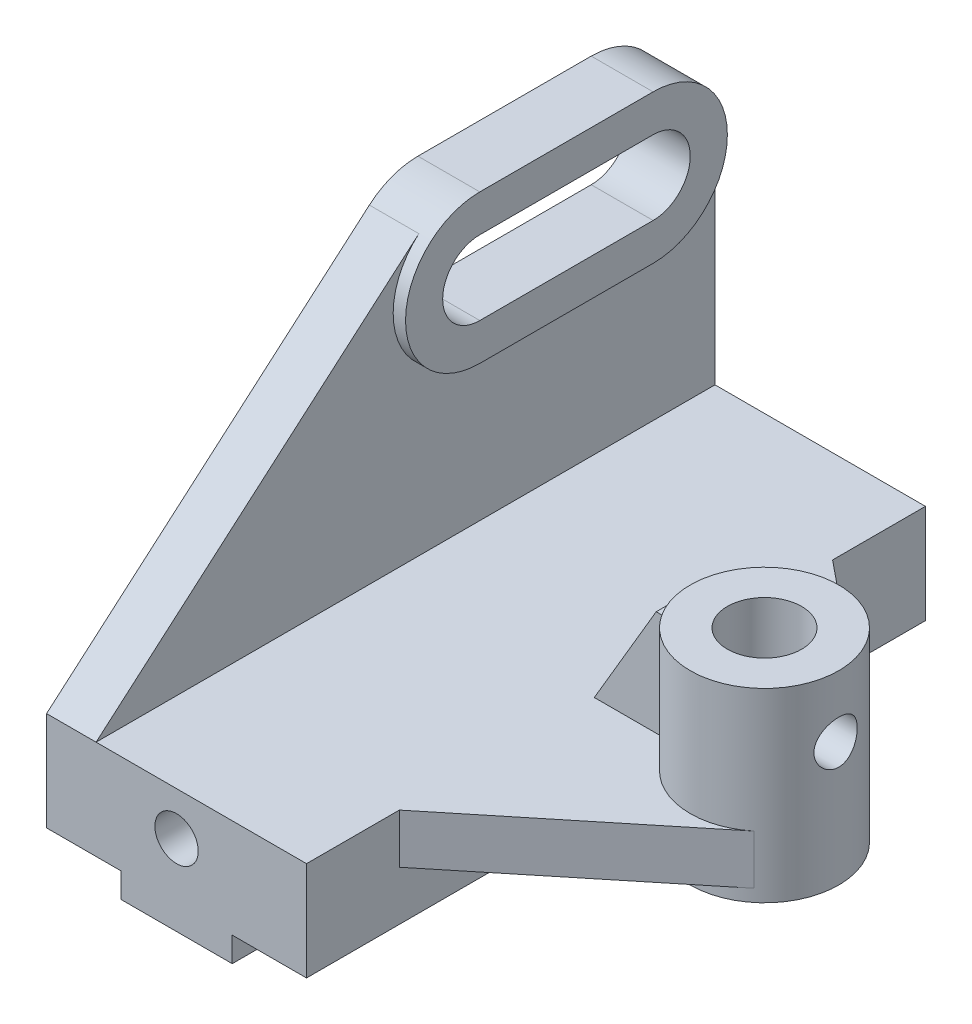
from build123d import *

# Parameters (mm, degrees)
SKETCH_1_R           = 3.5
EXTRUDE_1_DEPTH      = 50
EXTRUDE_2_DEPTH      = 8
EXTRUDE_3_DEPTH      = 10
EXTRUDE_4_DEPTH      = 8
EXTRUDE_5_DEPTH      = 20
EXTRUDE_5_DEPTH_BACK = 10
SKETCH_3_3_R         = 12
SKETCH_3_3_R_2       = 6
RIB_START            = -3.5
RIB_12_DEPTH         = 7
CUT_EXTRUDE_START    = 49.873397053
CUT_EXTRUDE_1_DEPTH  = 7.126602664


# Read off the part's stored shape, not the designer's step: 筋12, 切除-拉伸1
with BuildPart() as part:
    # 草图1 → 凸台-拉伸1 (new, symmetric)
    with BuildSketch(Plane.XY):
        Polygon((21, 7), (-21, 7), (-21, -9), (-9, -9), (-9, -13), (9, -13), (9, -9), (21, -9), align=None)
        Circle(SKETCH_1_R, mode=Mode.SUBTRACT)
    extrude(amount=EXTRUDE_1_DEPTH, both=True)

    # 草图2 → 凸台-拉伸2 (add)
    with BuildSketch(Plane.ZY.offset(21)):
        with BuildLine():
            Line((-50, 43), (-50, 7))
            Line((-50, 7), (50, 7))
            Line((50, 7), (-2.152816021, 52.078639964))
            ThreePointArc((-2.152816021, 52.078639964), (1.245969935, 38.813335431), (-10, 31))
            Line((-10, 31), (-38, 31))
            ThreePointArc((-38, 31), (-46.485281374, 34.514718626), (-50, 43))
        make_face()
    extrude(amount=-EXTRUDE_2_DEPTH)

    # 草图2<3> → 凸台-拉伸3 (add)
    with BuildSketch(Plane.ZY.offset(21)):
        with BuildLine():
            Line((-10, 55), (-38, 55))
            ThreePointArc((-38, 55), (-50, 43), (-38, 31))
            Line((-38, 31), (-10, 31))
            ThreePointArc((-10, 31), (2, 43), (-10, 55))
        make_face()
        with BuildLine():
            ThreePointArc((-38, 49), (-44, 43), (-38, 37))
            Line((-38, 37), (-10, 37))
            ThreePointArc((-10, 37), (-4, 43), (-10, 49))
            Line((-10, 49), (-38, 49))
        make_face(mode=Mode.SUBTRACT)
    extrude(amount=-EXTRUDE_3_DEPTH)

    # 草图3 → 凸台-拉伸4 (add)
    with BuildSketch(Plane(origin=(0, 7, 0), x_dir=(1, 0, 0), z_dir=(0, 1, 0))):
        with BuildLine():
            Line((33, 0), (21, 0))
            Line((21, 0), (21, -35))
            Line((21, -35), (52.573920737, -9.307831362))
            ThreePointArc((52.573920737, -9.307831362), (39.846702456, -10.837136357), (33, 0))
        make_face()
        with BuildLine():
            Line((21, 35), (21, 0))
            Line((21, 0), (33, 0))
            ThreePointArc((33, 0), (39.846702456, 10.837136357), (52.573920737, 9.307831362))
            Line((52.573920737, 9.307831362), (21, 35))
        make_face()
    extrude(amount=-EXTRUDE_4_DEPTH)

    # 草图3<3> → 凸台-拉伸5 (add, two sides: drawn at the far end of the back side and taken through both)
    with BuildSketch(Plane(origin=(0, 7, 0), x_dir=(1, 0, 0), z_dir=(0, 1, 0)).offset(-EXTRUDE_5_DEPTH_BACK)):
        with Locations(Location((45, 0, 0), (0, 0, 270))):
            Circle(SKETCH_3_3_R)
        with Locations(Location((45, 0, 0), (0, 0, 270))):
            Circle(SKETCH_3_3_R_2, mode=Mode.SUBTRACT)
    extrude(amount=EXTRUDE_5_DEPTH + EXTRUDE_5_DEPTH_BACK)

    # 筋12 outline → 筋12 (add)
    with BuildSketch(Plane.XY.offset(RIB_START)):
        Polygon((35, 24), (31, 24), (21, 7), (35, 7), align=None)
    extrude(amount=RIB_12_DEPTH)

    # 切除-拉伸1 outline → 切除-拉伸1 (cut)
    with BuildSketch(Plane(origin=(0, 0, 0), x_dir=(0, 0, -1), z_dir=(1, 0, 0)).offset(CUT_EXTRUDE_START)):
        with BuildLine():
            add(Edge.make_bspline(
                [(-3.5, 17), (-3.5, 17.930374798), (-3.116526668, 18.833354303), (-1.832705903, 20.11690801), (-0.921038324, 20.499404533), (0.916507131, 20.500594001), (1.828824497, 20.121110709), (3.121641798, 18.827917827), (3.499603295, 17.918268751), (3.500396051, 16.084757844), (3.121933694, 15.173019649), (1.831002297, 13.880423461), (0.924027469, 13.500295231), (-0.921789584, 13.499705127), (-1.831835104, 13.88257801), (-3.116022585, 15.165785464), (-3.5, 16.069625202), (-3.5, 17)],
                knots=[0, 0, 0, 0, 0.125, 0.125, 0.25, 0.25, 0.375, 0.375, 0.5, 0.5, 0.625, 0.625, 0.75, 0.75, 0.875, 0.875, 1, 1, 1, 1], degree=3))
        make_face()
    extrude(amount=CUT_EXTRUDE_1_DEPTH, mode=Mode.SUBTRACT)


solid = part.part
